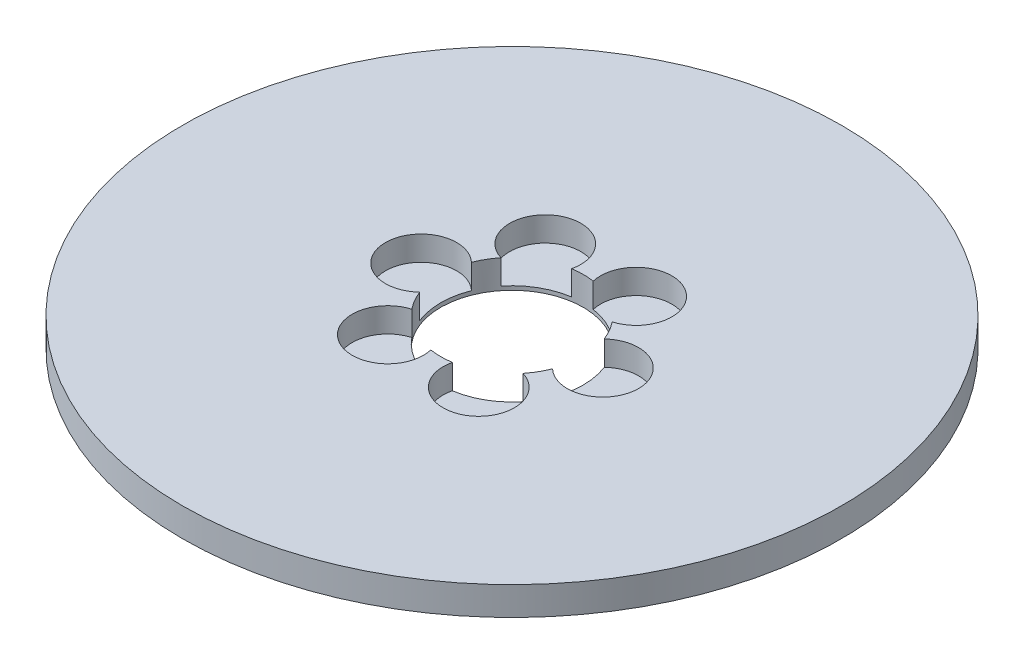
from build123d import *

# Parameters (mm, degrees)
SKETCH1_R           = 92.5
BOSS_EXTRUDE1_DEPTH = 8
SKETCH2_R           = 20
CUT_EXTRUDE1_DEPTH  = 132.059146953
SKETCH3_R           = 10
CUT_EXTRUDE2_DEPTH  = 6.885447698
CIRPATTERN1_COUNT   = 6


with BuildPart() as part:
    # Sketch1 → Boss-Extrude1 (new body)
    with BuildSketch(Plane(origin=(0, 0, 0), x_dir=(1, 0, 0), z_dir=(0, 1, 0))):
        Circle(SKETCH1_R)
    extrude(amount=BOSS_EXTRUDE1_DEPTH)

    # Sketch2 → Cut-Extrude1 (cut, through all)
    with BuildSketch(Plane(origin=(0, 0, 0), x_dir=(1, 0, 0), z_dir=(0, 1, 0))):
        Circle(SKETCH2_R)
    extrude(amount=CUT_EXTRUDE1_DEPTH, mode=Mode.SUBTRACT)

    # Sketch3 → Cut-Extrude2 (cut)
    with BuildSketch(Plane(origin=(0, 8, 0), x_dir=(1, 0, 0), z_dir=(0, 1, 0))):
        with Locations((-25.516109786, 0)):
            Circle(SKETCH3_R)
    cut_extrude2 = extrude(amount=-CUT_EXTRUDE2_DEPTH, mode=Mode.SUBTRACT)

    # CirPattern1: Cut-Extrude2 ×6 about axis
    cirpattern1_axis = Axis((0, 0, 0), (0, 1, 0))
    for i in range(1, CIRPATTERN1_COUNT):
        add(cut_extrude2.rotate(cirpattern1_axis, i * 360 / CIRPATTERN1_COUNT), mode=Mode.SUBTRACT)


solid = part.part
